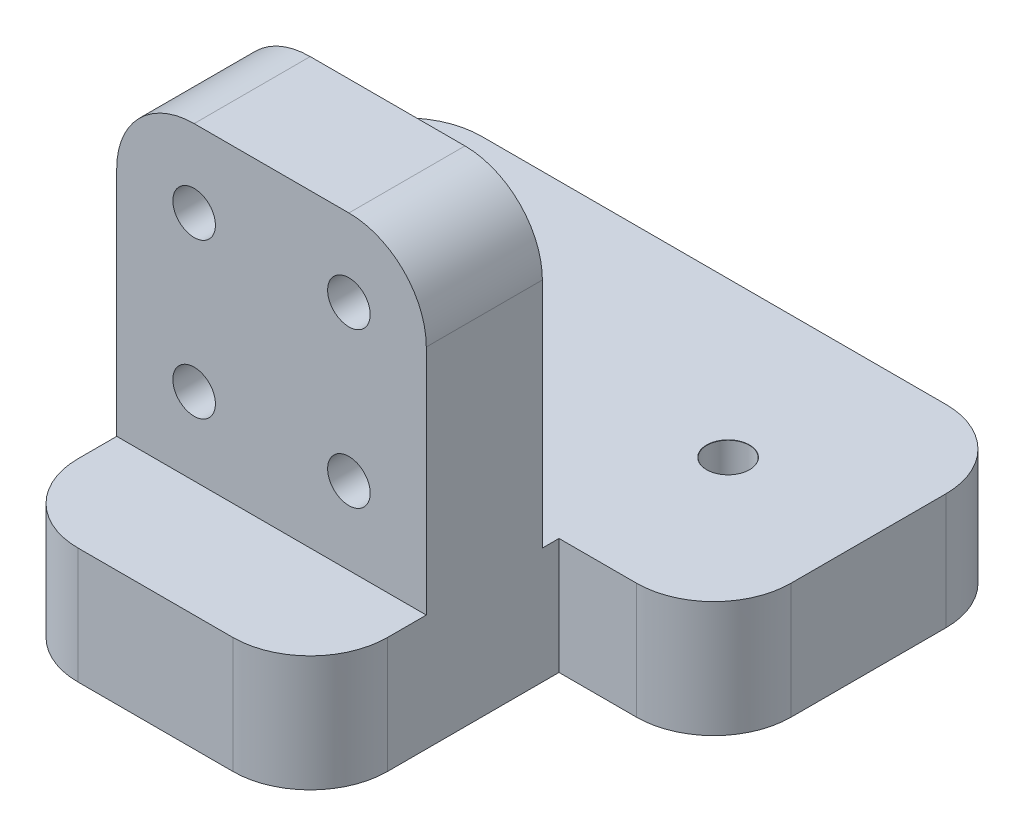
from build123d import *

# Parameters (mm, degrees)
BOSS_EXTRUDE1_DEPTH            = 15
M5_CLEARANCE_HOLE1_D           = 5.5
M5_CLEARANCE_HOLE1_CSINK_D     = 5.55
M5_CLEARANCE_HOLE1_CSINK_ANGLE = 90
SKETCH8_W                      = 40
SKETCH8_H                      = 15
BOSS_EXTRUDE2_DEPTH            = 40
M5_CLEARANCE_HOLE2_D           = 5.5
M5_CLEARANCE_HOLE2_CSINK_D     = 5.55
M5_CLEARANCE_HOLE2_CSINK_ANGLE = 90
FILLET2_R                      = 10


with BuildPart() as part:
    # Sketch1 → Boss-Extrude1 (new body)
    with BuildSketch(Plane(origin=(0, 0, 0), x_dir=(1, 0, 0), z_dir=(0, 1, 0))):
        Polygon((0, 32.15), (0, 0), (40, 0), (40, 32.15), (60, 32.15), (60, 72.15), (-20, 72.15), (-20, 32.15), align=None)
    extrude(amount=BOSS_EXTRUDE1_DEPTH)

    # M5 Clearance Hole1 (through all)
    with Locations(Plane(origin=(0, 15, 0), x_dir=(1, 0, 0), z_dir=(0, 1, 0))):
        with Locations((-1.85, 52.15), (41.85, 52.15)):
            CounterSinkHole(M5_CLEARANCE_HOLE1_D / 2, M5_CLEARANCE_HOLE1_CSINK_D / 2, counter_sink_angle=M5_CLEARANCE_HOLE1_CSINK_ANGLE)

    # Sketch8 → Boss-Extrude2 (add)
    with BuildSketch(Plane(origin=(0, 15, 0), x_dir=(1, 0, 0), z_dir=(0, 1, 0))):
        with Locations((20, 22.5)):
            Rectangle(SKETCH8_W, SKETCH8_H)
    extrude(amount=BOSS_EXTRUDE2_DEPTH)

    # M5 Clearance Hole2 (through all)
    with Locations(Plane(origin=(0, 0, -30), x_dir=(-1, 0, 0), z_dir=(0, 0, -1))):
        with Locations((-10, 25), (-30, 45), (-30, 25), (-10, 45)):
            CounterSinkHole(M5_CLEARANCE_HOLE2_D / 2, M5_CLEARANCE_HOLE2_CSINK_D / 2, counter_sink_angle=M5_CLEARANCE_HOLE2_CSINK_ANGLE)

    # Fillet2
    fillet2_edges = [part.edges().sort_by_distance(p)[0] for p in [
        (40, 55, -22.5),
        (0, 55, -22.5),
        (-20, 7.5, -32.15),
        (0, 7.5, 0),
        (40, 7.5, 0),
        (60, 7.5, -32.15),
        (60, 7.5, -72.15),
        (-20, 7.5, -72.15),
    ]]
    fillet(fillet2_edges, radius=FILLET2_R)


solid = part.part
